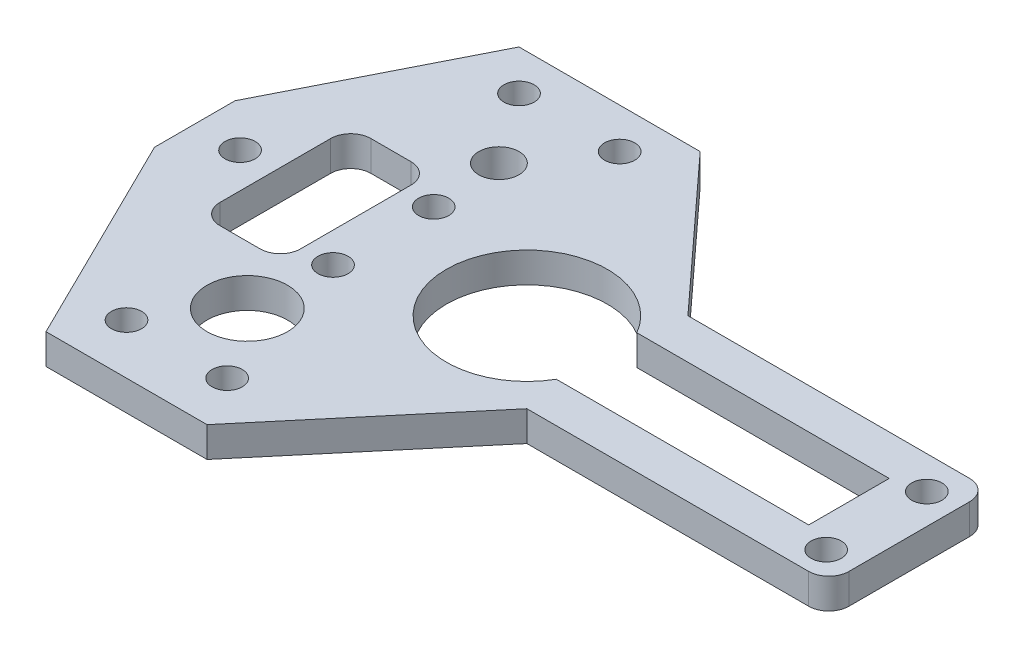
from build123d import *

# Parameters (mm, degrees)
BASE_FLANGE1_DEPTH = 3
CUT_EXTRUDE1_REACH = 60.356
CUT_EXTRUDE2_REACH = 60.356
SKETCH3_R          = 1.5
SKETCH3_W          = 8
SKETCH3_H          = 15
CUT_EXTRUDE3_REACH = 60.356
SKETCH4_R          = 1.5
CUT_EXTRUDE4_REACH = 60.356
SKETCH5_R          = 2
SKETCH5_R_2        = 4
FILLET1_R          = 2


# Sheet-metal steps are written as plain solids
with BuildPart() as part:
    # Sketch1 → Base-Flange1 (new body)
    with BuildSketch(Plane(origin=(0, 0, 0), x_dir=(1, 0, 0), z_dir=(0, 1, 0))):
        Polygon((-18.480295105, -4), (-18.480295105, 4), (-9, 22.738303144), (9, 22.738303144), (22.519704895, 8), (52.519704895, 8), (52.519704895, -8), (22.519704895, -8), (8, -25.261696856), (-8, -25.261696856), align=None)
    extrude(amount=BASE_FLANGE1_DEPTH)

    # Sketch2 → Cut-Extrude1 (cut, up to next)
    with BuildSketch(Plane(origin=(0, 3, 0), x_dir=(1, 0, 0), z_dir=(0, 1, 0)), mode=Mode.PRIVATE) as cut_extrude1_sk1:
        with BuildLine():
            Line((21.447908125, 4), (46.519704895, 4))
            Line((46.519704895, 4), (46.519704895, -4))
            Line((46.519704895, -4), (21.447908125, -4))
            ThreePointArc((21.447908125, -4), (6.519704895, 0), (21.447908125, 4))
        make_face()
    cut_extrude1_tool1 = extrude(cut_extrude1_sk1.sketch, amount=-CUT_EXTRUDE1_REACH, mode=Mode.PRIVATE) & part.part
    add(cut_extrude1_tool1.solids().sort_by_distance((24.274518, 3, 0))[0], mode=Mode.SUBTRACT)

    # Sketch3 → Cut-Extrude2 (cut, up to next)
    with BuildSketch(Plane(origin=(0, 3, 0), x_dir=(1, 0, 0), z_dir=(0, 1, 0)), mode=Mode.PRIVATE) as cut_extrude2_sk1:
        with Locations(Location((-13.980295105, 0, 0), (0, 0, 270))):
            Circle(SKETCH3_R)
    cut_extrude2_tool1 = extrude(cut_extrude2_sk1.sketch, amount=-CUT_EXTRUDE2_REACH, mode=Mode.PRIVATE) & part.part
    # Sketch3 → Cut-Extrude2 (cut, up to next)
    with BuildSketch(Plane(origin=(0, 3, 0), x_dir=(1, 0, 0), z_dir=(0, 1, 0)), mode=Mode.PRIVATE) as cut_extrude2_sk2:
        with Locations((-6.480295105, 0)):
            Rectangle(SKETCH3_W, SKETCH3_H)
    cut_extrude2_tool2 = extrude(cut_extrude2_sk2.sketch, amount=-CUT_EXTRUDE2_REACH, mode=Mode.PRIVATE) & part.part
    add(cut_extrude2_tool1.solids().sort_by_distance((-13.980295, 3, 0))[0], mode=Mode.SUBTRACT)
    add(cut_extrude2_tool2.solids().sort_by_distance((-6.480295, 3, 0))[0], mode=Mode.SUBTRACT)

    # Sketch4 → Cut-Extrude3 (cut, up to next)
    with BuildSketch(Plane(origin=(0, 3, 0), x_dir=(1, 0, 0), z_dir=(0, 1, 0)), mode=Mode.PRIVATE) as cut_extrude3_sk1:
        with Locations(Location((-5, 18.738303144, 0), (0, 0, 270))):
            Circle(SKETCH4_R)
    cut_extrude3_tool1 = extrude(cut_extrude3_sk1.sketch, amount=-CUT_EXTRUDE3_REACH, mode=Mode.PRIVATE) & part.part
    # Sketch4 → Cut-Extrude3 (cut, up to next)
    with BuildSketch(Plane(origin=(0, 3, 0), x_dir=(1, 0, 0), z_dir=(0, 1, 0)), mode=Mode.PRIVATE) as cut_extrude3_sk2:
        with Locations(Location((5, 18.738303144, 0), (0, 0, 270))):
            Circle(SKETCH4_R)
    cut_extrude3_tool2 = extrude(cut_extrude3_sk2.sketch, amount=-CUT_EXTRUDE3_REACH, mode=Mode.PRIVATE) & part.part
    # Sketch4 → Cut-Extrude3 (cut, up to next)
    with BuildSketch(Plane(origin=(0, 3, 0), x_dir=(1, 0, 0), z_dir=(0, 1, 0)), mode=Mode.PRIVATE) as cut_extrude3_sk3:
        with Locations(Location((0.519704895, 4.738303144, 0), (0, 0, 270))):
            Circle(SKETCH4_R)
    cut_extrude3_tool3 = extrude(cut_extrude3_sk3.sketch, amount=-CUT_EXTRUDE3_REACH, mode=Mode.PRIVATE) & part.part
    # Sketch4 → Cut-Extrude3 (cut, up to next)
    with BuildSketch(Plane(origin=(0, 3, 0), x_dir=(1, 0, 0), z_dir=(0, 1, 0)), mode=Mode.PRIVATE) as cut_extrude3_sk4:
        with Locations(Location((-5, -20.261696856, 0), (0, 0, 270))):
            Circle(SKETCH4_R)
    cut_extrude3_tool4 = extrude(cut_extrude3_sk4.sketch, amount=-CUT_EXTRUDE3_REACH, mode=Mode.PRIVATE) & part.part
    # Sketch4 → Cut-Extrude3 (cut, up to next)
    with BuildSketch(Plane(origin=(0, 3, 0), x_dir=(1, 0, 0), z_dir=(0, 1, 0)), mode=Mode.PRIVATE) as cut_extrude3_sk5:
        with Locations(Location((5, -20.261696856, 0), (0, 0, 270))):
            Circle(SKETCH4_R)
    cut_extrude3_tool5 = extrude(cut_extrude3_sk5.sketch, amount=-CUT_EXTRUDE3_REACH, mode=Mode.PRIVATE) & part.part
    # Sketch4 → Cut-Extrude3 (cut, up to next)
    with BuildSketch(Plane(origin=(0, 3, 0), x_dir=(1, 0, 0), z_dir=(0, 1, 0)), mode=Mode.PRIVATE) as cut_extrude3_sk6:
        with Locations(Location((0.519704895, -5.261696856, 0), (0, 0, 270))):
            Circle(SKETCH4_R)
    cut_extrude3_tool6 = extrude(cut_extrude3_sk6.sketch, amount=-CUT_EXTRUDE3_REACH, mode=Mode.PRIVATE) & part.part
    # Sketch4 → Cut-Extrude3 (cut, up to next)
    with BuildSketch(Plane(origin=(0, 3, 0), x_dir=(1, 0, 0), z_dir=(0, 1, 0)), mode=Mode.PRIVATE) as cut_extrude3_sk7:
        with Locations(Location((49.519704895, 4.738303144, 0), (0, 0, 270))):
            Circle(SKETCH4_R)
    cut_extrude3_tool7 = extrude(cut_extrude3_sk7.sketch, amount=-CUT_EXTRUDE3_REACH, mode=Mode.PRIVATE) & part.part
    # Sketch4 → Cut-Extrude3 (cut, up to next)
    with BuildSketch(Plane(origin=(0, 3, 0), x_dir=(1, 0, 0), z_dir=(0, 1, 0)), mode=Mode.PRIVATE) as cut_extrude3_sk8:
        with Locations(Location((49.519704895, -5.261696856, 0), (0, 0, 270))):
            Circle(SKETCH4_R)
    cut_extrude3_tool8 = extrude(cut_extrude3_sk8.sketch, amount=-CUT_EXTRUDE3_REACH, mode=Mode.PRIVATE) & part.part
    add(cut_extrude3_tool1.solids().sort_by_distance((-5, 3, -18.738303))[0], mode=Mode.SUBTRACT)
    add(cut_extrude3_tool2.solids().sort_by_distance((5, 3, -18.738303))[0], mode=Mode.SUBTRACT)
    add(cut_extrude3_tool3.solids().sort_by_distance((0.519705, 3, -4.738303))[0], mode=Mode.SUBTRACT)
    add(cut_extrude3_tool4.solids().sort_by_distance((-5, 3, 20.261697))[0], mode=Mode.SUBTRACT)
    add(cut_extrude3_tool5.solids().sort_by_distance((5, 3, 20.261697))[0], mode=Mode.SUBTRACT)
    add(cut_extrude3_tool6.solids().sort_by_distance((0.519705, 3, 5.261697))[0], mode=Mode.SUBTRACT)
    add(cut_extrude3_tool7.solids().sort_by_distance((49.519705, 3, -4.738303))[0], mode=Mode.SUBTRACT)
    add(cut_extrude3_tool8.solids().sort_by_distance((49.519705, 3, 5.261697))[0], mode=Mode.SUBTRACT)

    # Sketch5 → Cut-Extrude4 (cut, up to next)
    with BuildSketch(Plane(origin=(0, 3, 0), x_dir=(1, 0, 0), z_dir=(0, 1, 0)), mode=Mode.PRIVATE) as cut_extrude4_sk1:
        with Locations(Location((0, 11.738303144, 0), (0, 0, 270))):
            Circle(SKETCH5_R)
    cut_extrude4_tool1 = extrude(cut_extrude4_sk1.sketch, amount=-CUT_EXTRUDE4_REACH, mode=Mode.PRIVATE) & part.part
    # Sketch5 → Cut-Extrude4 (cut, up to next)
    with BuildSketch(Plane(origin=(0, 3, 0), x_dir=(1, 0, 0), z_dir=(0, 1, 0)), mode=Mode.PRIVATE) as cut_extrude4_sk2:
        with Locations(Location((0, -13.261696856, 0), (0, 0, 270))):
            Circle(SKETCH5_R_2)
    cut_extrude4_tool2 = extrude(cut_extrude4_sk2.sketch, amount=-CUT_EXTRUDE4_REACH, mode=Mode.PRIVATE) & part.part
    add(cut_extrude4_tool1.solids().sort_by_distance((0, 3, -11.738303))[0], mode=Mode.SUBTRACT)
    add(cut_extrude4_tool2.solids().sort_by_distance((0, 3, 13.261697))[0], mode=Mode.SUBTRACT)

    # Fillet1
    fillet1_edges = [part.edges().sort_by_distance(p)[0] for p in [
        (52.519704895, 1.5, -8),
        (52.519704895, 1.5, 8),
        (-2.480295105, 1.5, -7.5),
        (-2.480295105, 1.5, 7.5),
        (-10.480295105, 1.5, 7.5),
        (-10.480295105, 1.5, -7.5),
    ]]
    fillet(fillet1_edges, radius=FILLET1_R)


solid = part.part
